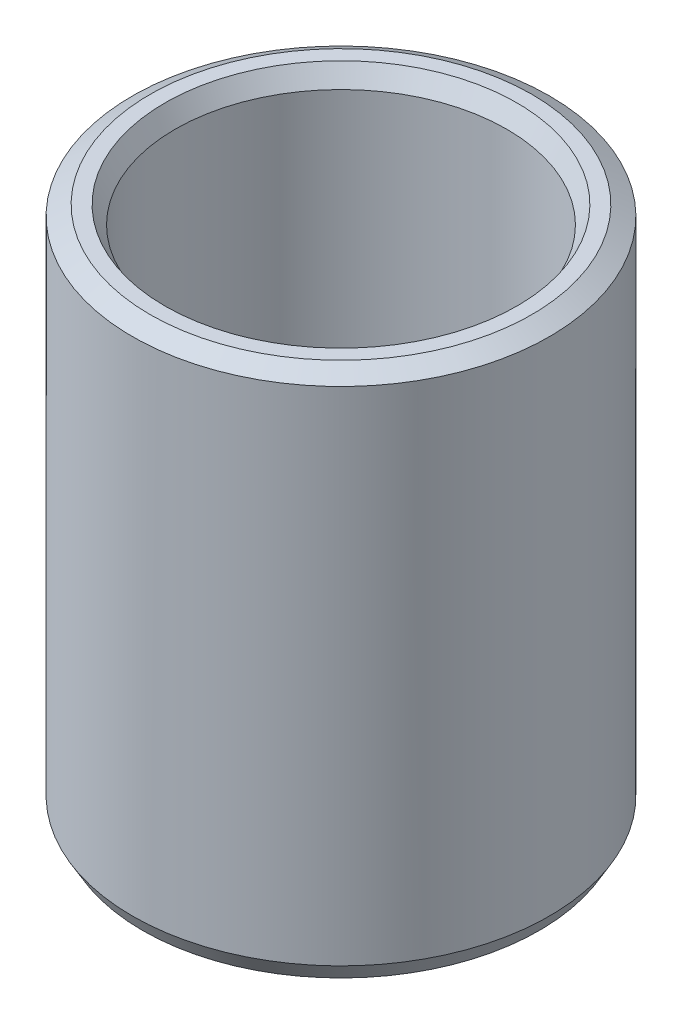
from build123d import *
from OCP.BRepFilletAPI import BRepFilletAPI_MakeChamfer

# Parameters (mm, degrees)
SKETCH1_R           = 45
BOSS_EXTRUDE1_DEPTH = 114.304376309
SKETCH2_R           = 35.779679934
CUT_EXTRUDE1_DEPTH  = 131.826184089
CHAMFER1_SIZE       = 2.203708476
CHAMFER1_SIZE2      = 3.816935045


with BuildPart() as part:
    # Sketch1 → Boss-Extrude1 (new body)
    with BuildSketch(Plane(origin=(0, 0, 0), x_dir=(1, 0, 0), z_dir=(0, 1, 0))):
        Circle(SKETCH1_R)
    extrude(amount=BOSS_EXTRUDE1_DEPTH)

    # Sketch2 → Cut-Extrude1 (cut, through all)
    with BuildSketch(Plane(origin=(0, 0, 0), x_dir=(1, 0, 0), z_dir=(0, 1, 0))):
        Circle(SKETCH2_R)
    extrude(amount=CUT_EXTRUDE1_DEPTH, mode=Mode.SUBTRACT)

    # Chamfer1: one chamfer whose edges measure the first distance from different faces: ONE call of the kernel's chamfer builder (chamfer() names one face for all edges)
    chamfer1_edges_1 = [part.edges().sort_by_distance(p)[0] for p in [
        (-35.779679934, 114.304376309, 0),
    ]]
    chamfer1_side_1 = [part.faces().sort_by_distance(p)[0] for p in [
        (-43.727207794, 114.304376309, 0),
    ]]
    chamfer1_edges_2 = [part.edges().sort_by_distance(p)[0] for p in [
        (-35.779679934, 0, 0),
    ]]
    chamfer1_side_2 = [part.faces().sort_by_distance(p)[0] for p in [
        (-35.779679934, 57.152188155, 0),
    ]]
    chamfer1_edges_3 = [part.edges().sort_by_distance(p)[0] for p in [
        (-45, 0, 0),
    ]]
    chamfer1_side_3 = [part.faces().sort_by_distance(p)[0] for p in [
        (-43.727207794, 0, 0),
    ]]
    chamfer1_edges_4 = [part.edges().sort_by_distance(p)[0] for p in [
        (-45, 114.304376309, 0),
    ]]
    chamfer1_side_4 = [part.faces().sort_by_distance(p)[0] for p in [
        (-45, 57.152188155, 0),
    ]]
    chamfer1 = BRepFilletAPI_MakeChamfer(part.part.solid().wrapped)
    for e in chamfer1_edges_1:
        chamfer1.Add(CHAMFER1_SIZE, CHAMFER1_SIZE2, e.wrapped, chamfer1_side_1[0].wrapped)  # the first distance lies on this face
    for e in chamfer1_edges_2:
        chamfer1.Add(CHAMFER1_SIZE, CHAMFER1_SIZE2, e.wrapped, chamfer1_side_2[0].wrapped)  # the first distance lies on this face
    for e in chamfer1_edges_3:
        chamfer1.Add(CHAMFER1_SIZE, CHAMFER1_SIZE2, e.wrapped, chamfer1_side_3[0].wrapped)  # the first distance lies on this face
    for e in chamfer1_edges_4:
        chamfer1.Add(CHAMFER1_SIZE, CHAMFER1_SIZE2, e.wrapped, chamfer1_side_4[0].wrapped)  # the first distance lies on this face
    add(Compound.cast(chamfer1.Shape()), mode=Mode.REPLACE)


solid = part.part
